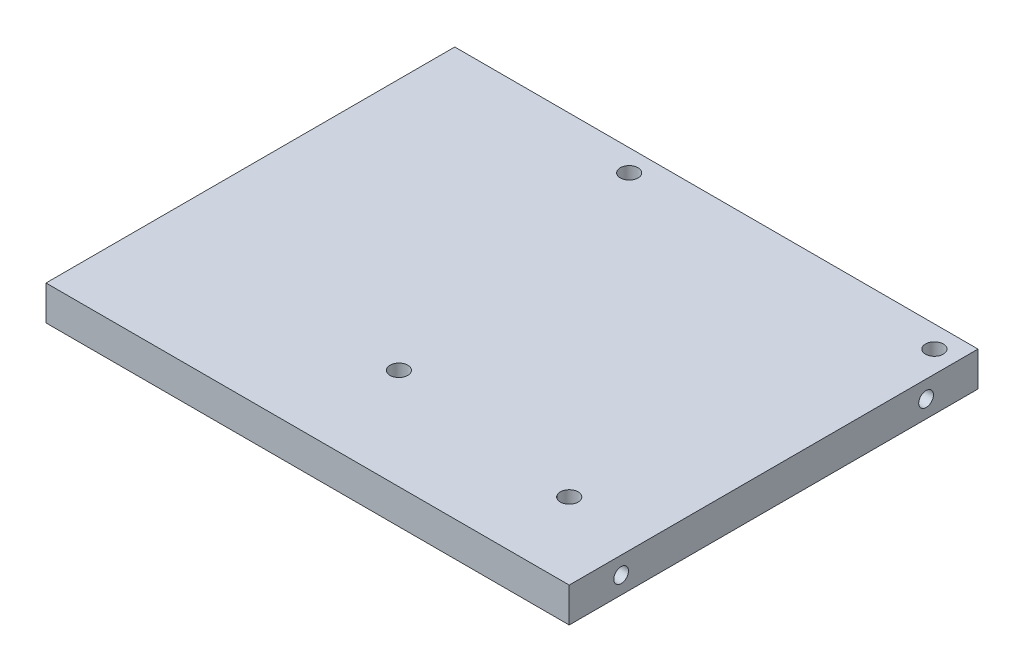
from build123d import *

# Parameters (mm, degrees)
SKETCH1_W           = 96
SKETCH1_H           = 75
BOSS_EXTRUDE1_DEPTH = 6.35
SKETCH2_R           = 1.63195
CUT_EXTRUDE1_DEPTH  = 6.35
SKETCH3_R           = 1.35255
CUT_EXTRUDE2_DEPTH  = 9.525
CUT_EXTRUDE3_START  = -9.525
SKETCH4_R           = 1.35255
CUT_EXTRUDE3_DEPTH  = 9.525


with BuildPart() as part:
    # Sketch1 → Boss-Extrude1 (new body)
    with BuildSketch(Plane(origin=(0, -8, 0), x_dir=(-1, 0, 0), z_dir=(0, -1, 0))):
        with Locations((-48, 37.5)):
            Rectangle(SKETCH1_W, SKETCH1_H)
    extrude(amount=-BOSS_EXTRUDE1_DEPTH)

    # Sketch2 → Cut-Extrude1 (cut)
    with BuildSketch(Plane.XZ.offset(8)):
        with Locations((36, -71)):
            Circle(SKETCH2_R)
        with Locations((46.25, -18.5)):
            Circle(SKETCH2_R)
        with Locations((82, -14)):
            Circle(SKETCH2_R)
        with Locations((92, -71)):
            Circle(SKETCH2_R)
    extrude(amount=-CUT_EXTRUDE1_DEPTH, mode=Mode.SUBTRACT)

    # Sketch3 → Cut-Extrude2 (cut)
    with BuildSketch(Plane.ZY):
        with Locations((-65.475, -4.825)):
            Circle(SKETCH3_R)
        with Locations((-9.525, -4.825)):
            Circle(SKETCH3_R)
    extrude(amount=-CUT_EXTRUDE2_DEPTH, mode=Mode.SUBTRACT)

    # Sketch4 → Cut-Extrude3 (cut)
    with BuildSketch(Plane(origin=(96, 0, 0), x_dir=(0, 0, -1), z_dir=(1, 0, 0)).offset(CUT_EXTRUDE3_START)):
        with Locations((65.475, -4.825)):
            Circle(SKETCH4_R)
        with Locations((9.525, -4.825)):
            Circle(SKETCH4_R)
    extrude(amount=CUT_EXTRUDE3_DEPTH, mode=Mode.SUBTRACT)


solid = part.part
